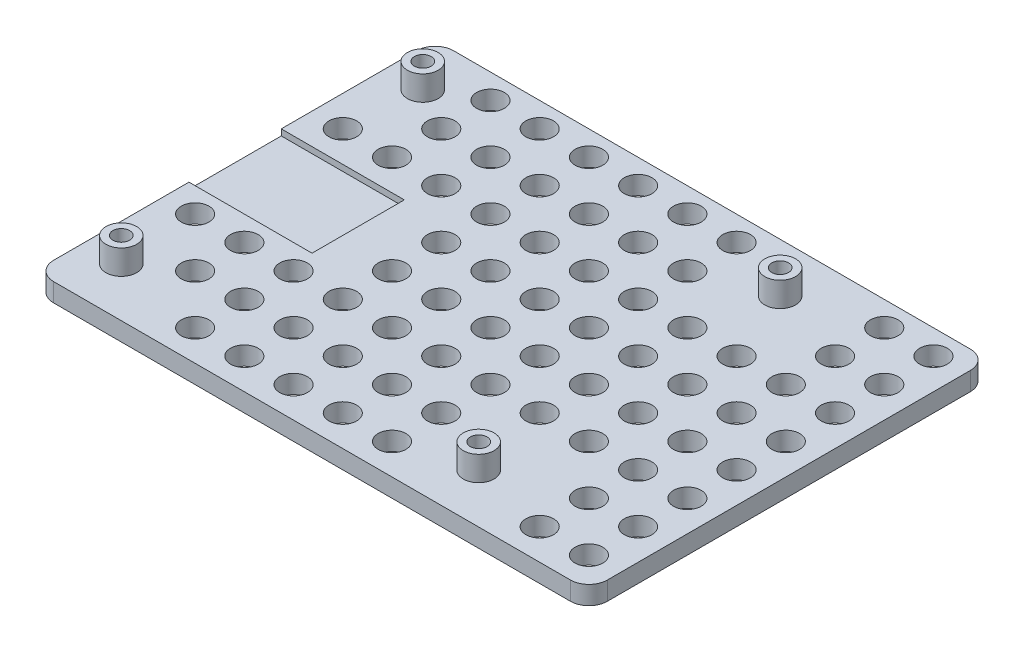
from build123d import *

# Parameters (mm, degrees)
SKIZZE1_W                       = 90
SKIZZE1_H                       = 65
AUFSATZ_LINEAR_AUSTRAGEN1_DEPTH = 3
SKIZZE2_W                       = 20
SKIZZE2_H                       = 15
SCHNITT_LINEAR_AUSTRAGEN1_DEPTH = 1
SKIZZE3_R                       = 2.5
AUFSATZ_LINEAR_AUSTRAGEN2_DEPTH = 4
SKIZZE4_R                       = 1.364499713
SCHNITT_LINEAR_AUSTRAGEN2_DEPTH = 56.948637159
VERRUNDUNG1_R                   = 3
SKIZZE5_R                       = 2.25
SCHNITT_LINEAR_AUSTRAGEN3_DEPTH = 56.65294242
F_LLMUSTER1_OUTLINE_R           = 2.25
F_LLMUSTER1_DEPTH               = 3


# Read off the part's stored shape, not the designer's step: Füllmuster1
with BuildPart() as part:
    # Skizze1 → Aufsatz-Linear austragen1 (new body)
    with BuildSketch(Plane(origin=(0, 0, 0), x_dir=(1, 0, 0), z_dir=(0, 1, 0))):
        Rectangle(SKIZZE1_W, SKIZZE1_H)
    extrude(amount=AUFSATZ_LINEAR_AUSTRAGEN1_DEPTH)

    # Skizze2 → Schnitt-Linear austragen1 (cut)
    with BuildSketch(Plane(origin=(0, 3, 0), x_dir=(1, 0, 0), z_dir=(0, 1, 0))):
        with Locations((-35, 0)):
            Rectangle(SKIZZE2_W, SKIZZE2_H)
    extrude(amount=-SCHNITT_LINEAR_AUSTRAGEN1_DEPTH, mode=Mode.SUBTRACT)

    # Skizze3 → Aufsatz-Linear austragen2 (add)
    with BuildSketch(Plane(origin=(0, 3, 0), x_dir=(1, 0, 0), z_dir=(0, 1, 0))):
        with Locations(Location((-39, 24.5, 0), (0, 0, 270))):
            Circle(SKIZZE3_R)
        with Locations(Location((19.085512482, 24.5, 0), (0, 0, 270))):
            Circle(SKIZZE3_R)
        with Locations(Location((19.085512482, -24.5, 0), (0, 0, 270))):
            Circle(SKIZZE3_R)
        with Locations(Location((-39, -24.5, 0), (0, 0, 270))):
            Circle(SKIZZE3_R)
    extrude(amount=AUFSATZ_LINEAR_AUSTRAGEN2_DEPTH)

    # Skizze4 → Schnitt-Linear austragen2 (cut, through all)
    with BuildSketch(Plane(origin=(0, 7, 0), x_dir=(1, 0, 0), z_dir=(0, 1, 0))):
        with Locations(Location((19.085512482, 24.5, 0), (0, 0, 270))):
            Circle(SKIZZE4_R)
        with Locations(Location((-39, 24.5, 0), (0, 0, 270))):
            Circle(SKIZZE4_R)
        with Locations(Location((-39, -24.5, 0), (0, 0, 270))):
            Circle(SKIZZE4_R)
        with Locations(Location((19.085512482, -24.5, 0), (0, 0, 270))):
            Circle(SKIZZE4_R)
    extrude(amount=-SCHNITT_LINEAR_AUSTRAGEN2_DEPTH, mode=Mode.SUBTRACT)

    # Verrundung1
    verrundung1_edges = [part.edges().sort_by_distance(p)[0] for p in [
        (-45, 1.5, 32.5),
        (-45, 1.5, -32.5),
        (45, 1.5, -32.5),
        (45, 1.5, 32.5),
    ]]
    fillet(verrundung1_edges, radius=VERRUNDUNG1_R)

    # Skizze5 → Schnitt-Linear austragen3 (cut, through all)
    with BuildSketch(Plane(origin=(0, 3, 0), x_dir=(1, 0, 0), z_dir=(0, 1, 0))):
        with Locations(Location((-32, 28.5, 0), (0, 0, 270))):
            Circle(SKIZZE5_R)
    extrude(amount=-SCHNITT_LINEAR_AUSTRAGEN3_DEPTH, mode=Mode.SUBTRACT)

    # Füllmuster1 outline → Füllmuster1 (cut)
    with BuildSketch(Plane(origin=(0, 0, 0), x_dir=(1, 0, 0), z_dir=(0, 1, 0))):
        with Locations((40, 28.5)):
            Circle(F_LLMUSTER1_OUTLINE_R)
        with Locations((-32, -19.5)):
            Circle(F_LLMUSTER1_OUTLINE_R)
        with Locations((-40, 12.5)):
            Circle(F_LLMUSTER1_OUTLINE_R)
        with Locations((-40, -11.5)):
            Circle(F_LLMUSTER1_OUTLINE_R)
        with Locations((16, 4.5)):
            Circle(F_LLMUSTER1_OUTLINE_R)
        with Locations((16, -3.5)):
            Circle(F_LLMUSTER1_OUTLINE_R)
        with Locations((16, -11.5)):
            Circle(F_LLMUSTER1_OUTLINE_R)
        with Locations((8, 28.5)):
            Circle(F_LLMUSTER1_OUTLINE_R)
        with Locations((24, 4.5)):
            Circle(F_LLMUSTER1_OUTLINE_R)
        with Locations((24, -3.5)):
            Circle(F_LLMUSTER1_OUTLINE_R)
        with Locations((24, -11.5)):
            Circle(F_LLMUSTER1_OUTLINE_R)
        with Locations((16, 12.5)):
            Circle(F_LLMUSTER1_OUTLINE_R)
        with Locations((8, -11.5)):
            Circle(F_LLMUSTER1_OUTLINE_R)
        with Locations((8, -19.5)):
            Circle(F_LLMUSTER1_OUTLINE_R)
        with Locations((8, -27.5)):
            Circle(F_LLMUSTER1_OUTLINE_R)
        with Locations((0, 28.5)):
            Circle(F_LLMUSTER1_OUTLINE_R)
        with Locations((8, -3.5)):
            Circle(F_LLMUSTER1_OUTLINE_R)
        with Locations((8, 4.5)):
            Circle(F_LLMUSTER1_OUTLINE_R)
        with Locations((8, 12.5)):
            Circle(F_LLMUSTER1_OUTLINE_R)
        with Locations((8, 20.5)):
            Circle(F_LLMUSTER1_OUTLINE_R)
        with Locations((40, -11.5)):
            Circle(F_LLMUSTER1_OUTLINE_R)
        with Locations((40, -19.5)):
            Circle(F_LLMUSTER1_OUTLINE_R)
        with Locations((40, -27.5)):
            Circle(F_LLMUSTER1_OUTLINE_R)
        with Locations((32, 28.5)):
            Circle(F_LLMUSTER1_OUTLINE_R)
        with Locations((40, -3.5)):
            Circle(F_LLMUSTER1_OUTLINE_R)
        with Locations((40, 4.5)):
            Circle(F_LLMUSTER1_OUTLINE_R)
        with Locations((40, 12.5)):
            Circle(F_LLMUSTER1_OUTLINE_R)
        with Locations((40, 20.5)):
            Circle(F_LLMUSTER1_OUTLINE_R)
        with Locations((32, -11.5)):
            Circle(F_LLMUSTER1_OUTLINE_R)
        with Locations((32, -19.5)):
            Circle(F_LLMUSTER1_OUTLINE_R)
        with Locations((32, -27.5)):
            Circle(F_LLMUSTER1_OUTLINE_R)
        with Locations((24, 12.5)):
            Circle(F_LLMUSTER1_OUTLINE_R)
        with Locations((32, -3.5)):
            Circle(F_LLMUSTER1_OUTLINE_R)
        with Locations((32, 4.5)):
            Circle(F_LLMUSTER1_OUTLINE_R)
        with Locations((32, 12.5)):
            Circle(F_LLMUSTER1_OUTLINE_R)
        with Locations((32, 20.5)):
            Circle(F_LLMUSTER1_OUTLINE_R)
        with Locations((-16, -11.5)):
            Circle(F_LLMUSTER1_OUTLINE_R)
        with Locations((-16, -19.5)):
            Circle(F_LLMUSTER1_OUTLINE_R)
        with Locations((-16, -27.5)):
            Circle(F_LLMUSTER1_OUTLINE_R)
        with Locations((-24, 28.5)):
            Circle(F_LLMUSTER1_OUTLINE_R)
        with Locations((-16, -3.5)):
            Circle(F_LLMUSTER1_OUTLINE_R)
        with Locations((-16, 4.5)):
            Circle(F_LLMUSTER1_OUTLINE_R)
        with Locations((-16, 12.5)):
            Circle(F_LLMUSTER1_OUTLINE_R)
        with Locations((-16, 20.5)):
            Circle(F_LLMUSTER1_OUTLINE_R)
        with Locations((-24, -27.5)):
            Circle(F_LLMUSTER1_OUTLINE_R)
        with Locations((-32, 20.5)):
            Circle(F_LLMUSTER1_OUTLINE_R)
        with Locations((-32, 12.5)):
            Circle(F_LLMUSTER1_OUTLINE_R)
        with Locations((-32, -11.5)):
            Circle(F_LLMUSTER1_OUTLINE_R)
        with Locations((-24, -19.5)):
            Circle(F_LLMUSTER1_OUTLINE_R)
        with Locations((-24, -11.5)):
            Circle(F_LLMUSTER1_OUTLINE_R)
        with Locations((-24, 12.5)):
            Circle(F_LLMUSTER1_OUTLINE_R)
        with Locations((-24, 20.5)):
            Circle(F_LLMUSTER1_OUTLINE_R)
        with Locations((0, -11.5)):
            Circle(F_LLMUSTER1_OUTLINE_R)
        with Locations((0, -19.5)):
            Circle(F_LLMUSTER1_OUTLINE_R)
        with Locations((0, -27.5)):
            Circle(F_LLMUSTER1_OUTLINE_R)
        with Locations((-8, 28.5)):
            Circle(F_LLMUSTER1_OUTLINE_R)
        with Locations((0, -3.5)):
            Circle(F_LLMUSTER1_OUTLINE_R)
        with Locations((0, 4.5)):
            Circle(F_LLMUSTER1_OUTLINE_R)
        with Locations((0, 12.5)):
            Circle(F_LLMUSTER1_OUTLINE_R)
        with Locations((0, 20.5)):
            Circle(F_LLMUSTER1_OUTLINE_R)
        with Locations((-8, -11.5)):
            Circle(F_LLMUSTER1_OUTLINE_R)
        with Locations((-8, -19.5)):
            Circle(F_LLMUSTER1_OUTLINE_R)
        with Locations((-8, -27.5)):
            Circle(F_LLMUSTER1_OUTLINE_R)
        with Locations((-16, 28.5)):
            Circle(F_LLMUSTER1_OUTLINE_R)
        with Locations((-8, -3.5)):
            Circle(F_LLMUSTER1_OUTLINE_R)
        with Locations((-8, 4.5)):
            Circle(F_LLMUSTER1_OUTLINE_R)
        with Locations((-8, 12.5)):
            Circle(F_LLMUSTER1_OUTLINE_R)
        with Locations((-8, 20.5)):
            Circle(F_LLMUSTER1_OUTLINE_R)
    extrude(amount=F_LLMUSTER1_DEPTH, mode=Mode.SUBTRACT)


solid = part.part
